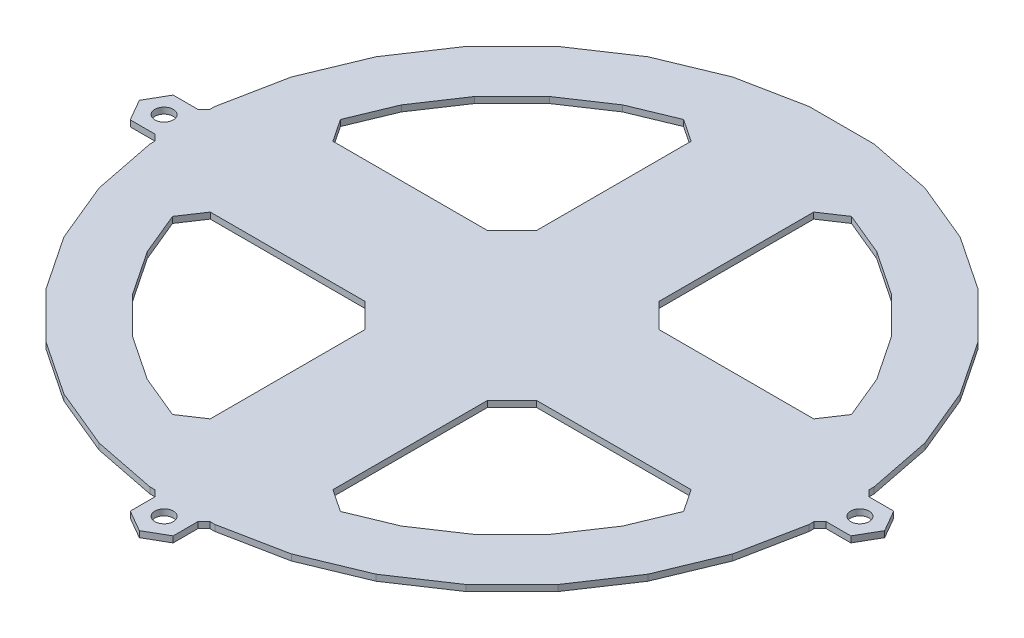
from build123d import *

# Parameters (mm, degrees)
BOSS_EXTRUDE1_DEPTH = 1
SKETCH3_W           = 20
SKETCH3_H           = 87.5
BOSS_EXTRUDE4_DEPTH = 1
CIRPATTERN1_COUNT   = 2
CIRPATTERN1_ANGLE   = 90
CHAMFER1_DEPTH      = 1
SKETCH5_R           = 1.5
BOSS_EXTRUDE6_DEPTH = 1
CHAMFER3_SIZE       = 1


with BuildPart() as part:
    # Sketch1 → Boss-Extrude1 (new body)
    with BuildSketch(Plane(origin=(0, 0, 0), x_dir=(1, 0, 0), z_dir=(0, 1, 0))):
        Polygon((53.75, 5.29391293), (51.684417643, 15.678296686), (47.632632102, 25.460172293), (41.750351221, 34.263627757), (34.263627757, 41.750351221), (25.460172293, 47.632632102), (15.678296686, 51.684417643), (5.29391293, 53.75), (-5.29391293, 53.75), (-15.678296686, 51.684417643), (-25.460172293, 47.632632102), (-34.263627757, 41.750351221), (-41.750351221, 34.263627757), (-47.632632102, 25.460172293), (-51.684417643, 15.678296686), (-53.75, 5.29391293), (-53.75, -5.29391293), (-51.684417643, -15.678296686), (-47.632632102, -25.460172293), (-41.750351221, -34.263627757), (-34.263627757, -41.750351221), (-25.460172293, -47.632632102), (-15.678296686, -51.684417643), (-5.29391293, -53.75), (5.29391293, -53.75), (15.678296686, -51.684417643), (25.460172293, -47.632632102), (34.263627757, -41.750351221), (41.750351221, -34.263627757), (47.632632102, -25.460172293), (51.684417643, -15.678296686), (53.75, -5.29391293), align=None)
        Polygon((43.75, 4.308998897), (42.068712035, 12.76140428), (38.770747059, 20.723396052), (33.982844017, 27.888999337), (27.888999337, 33.982844017), (20.723396052, 38.770747059), (12.76140428, 42.068712035), (4.308998897, 43.75), (-4.308998897, 43.75), (-12.76140428, 42.068712035), (-20.723396052, 38.770747059), (-27.888999337, 33.982844017), (-33.982844017, 27.888999337), (-38.770747059, 20.723396052), (-42.068712035, 12.76140428), (-43.75, 4.308998897), (-43.75, -4.308998897), (-42.068712035, -12.76140428), (-38.770747059, -20.723396052), (-33.982844017, -27.888999337), (-27.888999337, -33.982844017), (-20.723396052, -38.770747059), (-12.76140428, -42.068712035), (-4.308998897, -43.75), (4.308998897, -43.75), (12.76140428, -42.068712035), (20.723396052, -38.770747059), (27.888999337, -33.982844017), (33.982844017, -27.888999337), (38.770747059, -20.723396052), (42.068712035, -12.76140428), (43.75, -4.308998897), align=None, mode=Mode.SUBTRACT)
    extrude(amount=BOSS_EXTRUDE1_DEPTH)

    # Sketch3 → Boss-Extrude4 (add)
    with BuildSketch(Plane(origin=(0, 1, 0), x_dir=(1, 0, 0), z_dir=(0, 1, 0))):
        Rectangle(SKETCH3_W, SKETCH3_H)
    boss_extrude4 = extrude(amount=-BOSS_EXTRUDE4_DEPTH)

    # CirPattern1: Boss-Extrude4 ×2 about axis
    cirpattern1_axis = Axis((0, 1, 0), (0, 1, 0))
    for i in range(1, CIRPATTERN1_COUNT):
        add(boss_extrude4.rotate(cirpattern1_axis, i * CIRPATTERN1_ANGLE / (CIRPATTERN1_COUNT - 1)))

    # Chamfer1: read off the stored shape, not the designer's step
    # Chamfer1 outline → Chamfer1 (add)
    with BuildSketch(Plane(origin=(0, 0, 0), x_dir=(1, 0, 0), z_dir=(0, 1, 0))):
        Polygon((10, -10), (10, -14), (14, -10), align=None)
        Polygon((13.692057296, -41.683222934), (10, -39.216269119), (10, -42.617989498), (12.76140428, -42.068712035), align=None)
        Polygon((42.617989498, -10), (39.216269119, -10), (41.683222934, -13.692057296), (42.068712035, -12.76140428), align=None)
        Polygon((-10, 10), (-10, 14), (-14, 10), align=None)
        Polygon((-13.692057296, 41.683222934), (-10, 39.216269119), (-10, 42.617989498), (-12.76140428, 42.068712035), align=None)
        Polygon((-42.617989498, 10), (-39.216269119, 10), (-41.683222934, 13.692057296), (-42.068712035, 12.76140428), align=None)
        Polygon((10, 10), (14, 10), (10, 14), align=None)
        Polygon((41.683222934, 13.692057296), (39.216269119, 10), (42.617989498, 10), (42.068712035, 12.76140428), align=None)
        Polygon((10, 42.617989498), (10, 39.216269119), (13.692057296, 41.683222934), (12.76140428, 42.068712035), align=None)
        Polygon((-10, -10), (-14, -10), (-10, -14), align=None)
        Polygon((-41.683222934, -13.692057296), (-39.216269119, -10), (-42.617989498, -10), (-42.068712035, -12.76140428), align=None)
        Polygon((-10, -42.617989498), (-10, -39.216269119), (-13.692057296, -41.683222934), (-12.76140428, -42.068712035), align=None)
    extrude(amount=CHAMFER1_DEPTH)

    # Sketch5 → Boss-Extrude6 (add)
    # profile 1 of 3: a face of its own
    with BuildSketch(Plane(origin=(0, 1, 0), x_dir=(1, 0, 0), z_dir=(0, 1, 0))):
        Polygon((-54.729274058, 3.5), (-58.770725942, 3.5), (-60.791451884, 0), (-58.770725942, -3.5), (-54.729274058, -3.5), (-53.75, -3.5), (-53.75, 3.5), align=None)
        with Locations(Location((-56.75, 0, 0), (0, 0, 270))):
            Circle(SKETCH5_R, mode=Mode.SUBTRACT)
    # profile 2 of 3: a face of its own
    with BuildSketch(Plane(origin=(0, 1, 0), x_dir=(1, 0, 0), z_dir=(0, 1, 0))):
        Polygon((54.729274058, 3.5), (53.75, 3.5), (53.75, -3.5), (54.729274058, -3.5), (58.770725942, -3.5), (60.791451884, 0), (58.770725942, 3.5), align=None)
        with Locations(Location((56.75, 0, 0), (0, 0, 270))):
            Circle(SKETCH5_R, mode=Mode.SUBTRACT)
    # profile 3 of 3: a face of its own
    with BuildSketch(Plane(origin=(0, 1, 0), x_dir=(1, 0, 0), z_dir=(0, 1, 0))):
        Polygon((3.5, -54.729274058), (3.5, -53.75), (-3.5, -53.75), (-3.5, -54.729274058), (-3.5, -58.770725942), (0, -60.791451884), (3.5, -58.770725942), align=None)
        with Locations(Location((0, -56.75, 0), (0, 0, 270))):
            Circle(SKETCH5_R, mode=Mode.SUBTRACT)
    extrude(amount=-BOSS_EXTRUDE6_DEPTH)

    # Chamfer3
    chamfer3_edges = [part.edges().sort_by_distance(p)[0] for p in [
        (-53.75, 0.5, 3.5),
        (-53.75, 0.5, -3.5),
        (53.75, 0.5, -3.5),
        (53.75, 0.5, 3.5),
        (3.5, 0.5, 53.75),
        (-3.5, 0.5, 53.75),
    ]]
    chamfer(chamfer3_edges, length=CHAMFER3_SIZE)


solid = part.part
